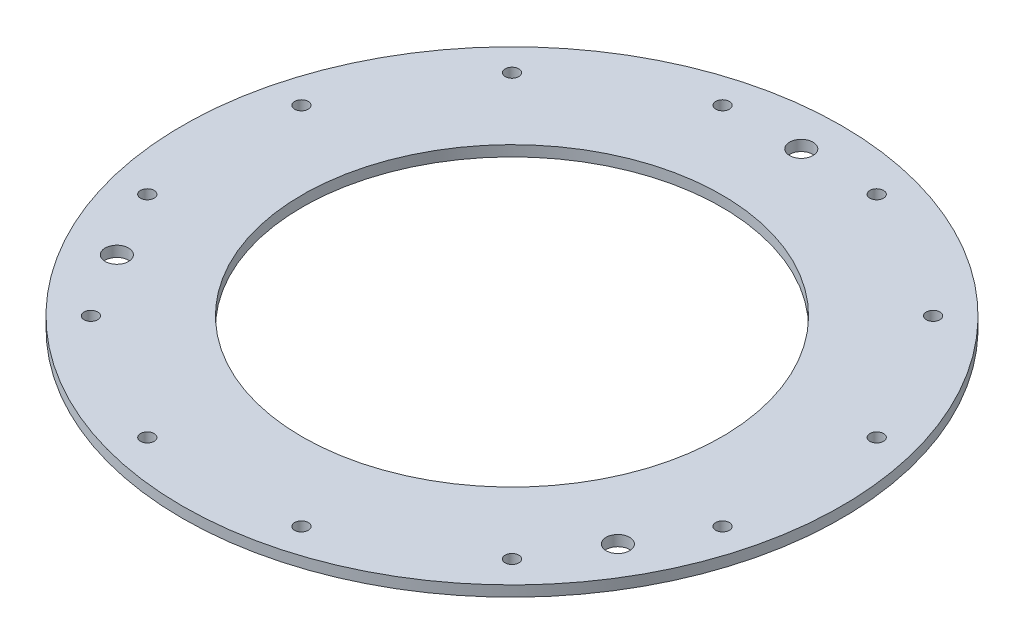
from build123d import *

# Parameters (mm, degrees)
SKETCH1_R           = 77.47
SKETCH1_R_2         = 49.3
BOSS_EXTRUDE1_DEPTH = 2.5
SKETCH2_R           = 1.6
CUT_EXTRUDE1_DEPTH  = 110.587644377
D_GAGEMENT_M52_D    = 5.5


with BuildPart() as part:
    # Sketch1 → Boss-Extrude1 (new body)
    with BuildSketch(Plane(origin=(0, 0, 0), x_dir=(1, 0, 0), z_dir=(0, 1, 0))):
        Circle(SKETCH1_R)
        Circle(SKETCH1_R_2, mode=Mode.SUBTRACT)
    extrude(amount=BOSS_EXTRUDE1_DEPTH)

    # Sketch2 → Cut-Extrude1 (cut, through all)
    with BuildSketch(Plane(origin=(0, 2.5, 0), x_dir=(1, 0, 0), z_dir=(0, 1, 0))):
        with Locations((-18.117333157, 67.61480784)):
            Circle(SKETCH2_R)
        with Locations((18.117333157, 67.61480784)):
            Circle(SKETCH2_R)
        with Locations((49.497474683, 49.497474683)):
            Circle(SKETCH2_R)
        with Locations((67.61480784, 18.117333157)):
            Circle(SKETCH2_R)
        with Locations((67.61480784, -18.117333157)):
            Circle(SKETCH2_R)
        with Locations((49.497474683, -49.497474683)):
            Circle(SKETCH2_R)
        with Locations((18.117333157, -67.61480784)):
            Circle(SKETCH2_R)
        with Locations((-18.117333157, -67.61480784)):
            Circle(SKETCH2_R)
        with Locations((-49.497474683, -49.497474683)):
            Circle(SKETCH2_R)
        with Locations((-67.61480784, -18.117333157)):
            Circle(SKETCH2_R)
        with Locations((-67.61480784, 18.117333157)):
            Circle(SKETCH2_R)
        with Locations((-49.497474683, 49.497474683)):
            Circle(SKETCH2_R)
    extrude(amount=-CUT_EXTRUDE1_DEPTH, mode=Mode.SUBTRACT)

    # Dégagement M52 (through all)
    with Locations(Plane(origin=(0, 2.5, 0), x_dir=(1, 0, 0), z_dir=(0, 1, 0))):
        with Locations((0, 68), (-58.889727457, -34), (58.889727457, -34)):
            Hole(D_GAGEMENT_M52_D / 2)


solid = part.part
